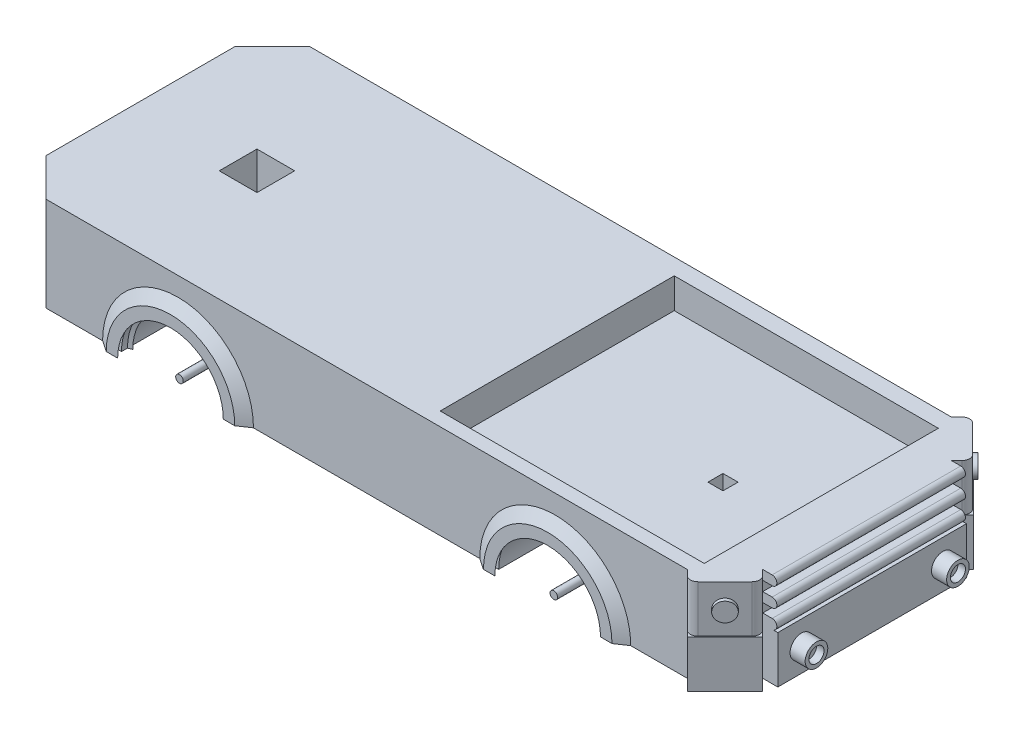
from build123d import *

# Parameters (mm, degrees)
SKETCH1_W                                  = 150
SKETCH1_H                                  = 70
BOSS_EXTRUDE1_DEPTH                        = 25
CUT_EXTRUDE3_DEPTH                         = 30
MIRROR9_ANGLE                              = 180
SKETCH6_R                                  = 15
CUT_EXTRUDE4_DEPTH                         = 30
SKETCH10_W                                 = 70
SKETCH10_H                                 = 25
BOSS_EXTRUDE3_DEPTH                        = 20
CHAMFER3_SIZE                              = 10
CHAMFER4_SIZE                              = 10
SKETCH11_W                                 = 14.142135624
SKETCH11_H                                 = 12.5
BOSS_EXTRUDE4_DEPTH                        = 4
SKETCH12_W                                 = 14.142135624
SKETCH12_H                                 = 12.5
BOSS_EXTRUDE5_DEPTH                        = 4.2
FILLET1_R                                  = 2
FILLET2_R                                  = 2
FILLET4_R                                  = 2
FILLET5_R                                  = 2
SKETCH13_W                                 = 50
SKETCH13_H                                 = 2.5
BOSS_EXTRUDE6_DEPTH                        = 2.5
BOSS_EXTRUDE8_DEPTH                        = 50
BOSS_EXTRUDE10_DEPTH                       = 50
SKETCH16_W                                 = 50
SKETCH16_H                                 = 12.5
BOSS_EXTRUDE11_DEPTH                       = 4
SKETCH17_R                                 = 3
BOSS_EXTRUDE12_DEPTH                       = 4
SKETCH18_R                                 = 2
CUT_EXTRUDE5_DEPTH                         = 2
SKETCH22_W                                 = 70
SKETCH22_H                                 = 25
BOSS_EXTRUDE13_DEPTH                       = 20
SKETCH27_W                                 = 19
SKETCH27_H                                 = 5.69724291
SKETCH27_W_2                               = 18
SKETCH27_W_3                               = 18.103539807
BOSS_EXTRUDE16_DEPTH                       = 1
SKETCH28_R                                 = 2.5
BOSS_EXTRUDE17_DEPTH                       = 1
CUT_EXTRUDE7_DEPTH                         = 30
SKETCH33_W                                 = 70
SKETCH33_H                                 = 62.057932372
CUT_EXTRUDE9_DEPTH                         = 8
SKETCH34_W                                 = 10
SKETCH34_H                                 = 10
CUT_EXTRUDE10_DEPTH                        = 10
MIRROR13_START                             = 170
MIRROR13_OUTLINE_R                         = 2
MIRROR13_DEPTH                             = 2
CHAMFER5_SIZE                              = 10
CHAMFER6_SIZE                              = 10
SKETCH35_R                                 = 3
BOSS_EXTRUDE18_DEPTH                       = 2
SKETCH38_R                                 = 2
CUT_EXTRUDE11_DEPTH                        = 1
MIRROR16_START                             = -21
MIRROR16_OUTLINE_R                         = 2
MIRROR16_DEPTH                             = 1
MIRROR16_START_2                           = -22
MIRROR16_2_OUTLINE_R                       = 3
MIRROR16_2_OUTLINE_R_2                     = 2
MIRROR16_2_DEPTH                           = 2
MIRROR16_3_OUTLINE_R                       = 2
MIRROR16_3_DEPTH                           = 1
SKETCH39_R                                 = 2
CUT_EXTRUDE12_DEPTH                        = 1
SKETCH40_W                                 = 4
SKETCH40_H                                 = 4
CUT_EXTRUDE13_DEPTH                        = 5
SKETCH41_R                                 = 1
BOSS_EXTRUDE19_DEPTH                       = 30
MIRROR17_AT_THE_SECOND_PLANE_COPY_1_SKET_R = 1
MIRROR17_AT_THE_SECOND_PLANE_COPY_1_DEPTH  = 30
SCALE1_SCALE                               = 0.9


# Read off the part's stored shape, not the designer's step: Mirror9, Mirror13, Mirror16
with BuildPart() as part:
    # Sketch1 → Boss-Extrude1 (new body)
    with BuildSketch(Plane(origin=(0, 0, 0), x_dir=(1, 0, 0), z_dir=(0, 1, 0))):
        with Locations((75, 35)):
            Rectangle(SKETCH1_W, SKETCH1_H)
    extrude(amount=BOSS_EXTRUDE1_DEPTH)

    # Sketch2 → Cut-Extrude3 (cut)
    with BuildSketch(Plane.XY):
        with BuildLine():
            ThreePointArc((40, 0), (25, 15), (10, 0))
            Line((10, 0), (40, 0))
        make_face()
    extrude(amount=-CUT_EXTRUDE3_DEPTH, mode=Mode.SUBTRACT)

    # Sketch4 → Loft2 section 0
    with BuildSketch(Plane.XY):
        with BuildLine():
            Line((5, 0), (6, 0))
            ThreePointArc((6, 0), (25, 19), (44, 0))
            Line((44, 0), (45, 0))
            ThreePointArc((45, 0), (25, 20), (5, 0))
        make_face()
    # Sketch3 → Loft2 section 1
    with BuildSketch(Plane.XY.offset(2)):
        with BuildLine():
            Line((39, 0), (42.033465093, 0))
            ThreePointArc((42.033465093, 0), (25, 17.033465093), (7.966534907, 0))
            Line((7.966534907, 0), (11, 0))
            ThreePointArc((11, 0), (25, 14), (39, 0))
        make_face()
    loft2 = loft()

    # Mirror4: Loft2 across plane
    add(loft2.mirror(Plane(origin=(0, 25, 0), x_dir=(1, 0, 0), z_dir=(0, 0, -1))))

    # Mirror5: Loft2 across plane
    add(loft2.mirror(Plane.ZY.offset(-75)))

    # Mirror8: Loft2 across plane
    add(loft2.mirror(Plane(origin=(0, 0, -35), x_dir=(1, 0, 0), z_dir=(0, 0, -1))))

    # Mirror9 outline → Mirror9 (revolve)
    with BuildSketch(Plane(origin=(125, 0, 0), x_dir=(1, 0, 0), z_dir=(0, -1, 0))):
        Polygon((19, -70), (14, -72), (17.033465093, -72), (20, -70), align=None)
    revolve(axis=Axis((125, 0, 0), (0, 0, 1)), revolution_arc=MIRROR9_ANGLE)

    # Sketch6 → Cut-Extrude4 (cut)
    with BuildSketch(Plane.XY):
        with Locations((125, 0)):
            Circle(SKETCH6_R)
    extrude(amount=-CUT_EXTRUDE4_DEPTH, mode=Mode.SUBTRACT)

    # Sketch10 → Boss-Extrude3 (add)
    with BuildSketch(Plane(origin=(150, 0, 0), x_dir=(0, 0, -1), z_dir=(1, 0, 0))):
        with Locations((35, 12.5)):
            Rectangle(SKETCH10_W, SKETCH10_H)
    extrude(amount=BOSS_EXTRUDE3_DEPTH)

    # Chamfer3
    chamfer3_edges = [part.edges().sort_by_distance(p)[0] for p in [
        (170, 12.5, -70),
    ]]
    chamfer(chamfer3_edges, length=CHAMFER3_SIZE)

    # Chamfer4
    chamfer4_edges = [part.edges().sort_by_distance(p)[0] for p in [
        (170, 12.5, 0),
    ]]
    chamfer(chamfer4_edges, length=CHAMFER4_SIZE)

    # Sketch11 → Boss-Extrude4 (add)
    with BuildSketch(Plane(origin=(80, 0, 80), x_dir=(0.7071067811865485, 0, -0.7071067811865467), z_dir=(0.7071067811865467, 0, 0.7071067811865485))):
        with Locations((120.208152802, 18.75)):
            Rectangle(SKETCH11_W, SKETCH11_H)
    boss_extrude4 = extrude(amount=BOSS_EXTRUDE4_DEPTH)

    # Sketch12 → Boss-Extrude5 (add)
    with BuildSketch(Plane(origin=(80, 0, 80), x_dir=(0.7071067811865485, 0, -0.7071067811865467), z_dir=(0.7071067811865467, 0, 0.7071067811865485))):
        with Locations((120.208152802, 6.25)):
            Rectangle(SKETCH12_W, SKETCH12_H)
    boss_extrude5 = extrude(amount=BOSS_EXTRUDE5_DEPTH)

    # Fillet1
    fillet1_edges = [part.edges().sort_by_distance(p)[0] for p in [
        (172.828427125, 18.75, -7.171572875),
    ]]
    fillet(fillet1_edges, radius=FILLET1_R)

    # Fillet2
    fillet2_edges = [part.edges().sort_by_distance(p)[0] for p in [
        (162.828427125, 18.75, 2.828427125),
    ]]
    fillet(fillet2_edges, radius=FILLET2_R)

    # Mirror10: Boss-Extrude4, Boss-Extrude5 across plane
    add(boss_extrude4.mirror(Plane(origin=(0, 0, -35), x_dir=(1, 0, 0), z_dir=(0, 0, -1))))
    add(boss_extrude5.mirror(Plane(origin=(0, 0, -35), x_dir=(1, 0, 0), z_dir=(0, 0, -1))))

    # Fillet4
    fillet4_edges = [part.edges().sort_by_distance(p)[0] for p in [
        (172.828427125, 18.75, -62.828427125),
    ]]
    fillet(fillet4_edges, radius=FILLET4_R)

    # Fillet5
    fillet5_edges = [part.edges().sort_by_distance(p)[0] for p in [
        (162.828427125, 18.75, -72.828427125),
    ]]
    fillet(fillet5_edges, radius=FILLET5_R)

    # Sketch13 → Boss-Extrude6 (add)
    with BuildSketch(Plane(origin=(170, 0, 0), x_dir=(0, 0, -1), z_dir=(1, 0, 0))):
        with Locations((35, 13.75)):
            Rectangle(SKETCH13_W, SKETCH13_H)
        with Locations((35, 18.657877469)):
            Rectangle(SKETCH13_W, SKETCH13_H)
        with Locations((35, 23.75)):
            Rectangle(SKETCH13_W, SKETCH13_H)
    extrude(amount=BOSS_EXTRUDE6_DEPTH)

    # Sketch14 → Boss-Extrude8 (add)
    with BuildSketch(Plane(origin=(0, 0, -60), x_dir=(-1, 0, 0), z_dir=(0, 0, -1))):
        with BuildLine():
            Line((-172.5, 25), (-172.5, 22.5))
            ThreePointArc((-172.5, 22.5), (-173.75, 23.75), (-172.5, 25))
        make_face()
    extrude(amount=-BOSS_EXTRUDE8_DEPTH)

    # Sketch15 → Boss-Extrude10 (add)
    with BuildSketch(Plane(origin=(0, 0, -60), x_dir=(-1, 0, 0), z_dir=(0, 0, -1))):
        with BuildLine():
            Line((-172.5, 19.907877469), (-172.5, 17.407877469))
            ThreePointArc((-172.5, 17.407877469), (-173.75, 18.657877469), (-172.5, 19.907877469))
        make_face()
        with BuildLine():
            Line((-172.5, 15), (-172.5, 12.5))
            ThreePointArc((-172.5, 12.5), (-173.75, 13.75), (-172.5, 15))
        make_face()
    extrude(amount=-BOSS_EXTRUDE10_DEPTH)

    # Sketch16 → Boss-Extrude11 (add)
    with BuildSketch(Plane(origin=(170, 0, 0), x_dir=(0, 0, -1), z_dir=(1, 0, 0))):
        with Locations((35, 6.25)):
            Rectangle(SKETCH16_W, SKETCH16_H)
    extrude(amount=BOSS_EXTRUDE11_DEPTH)

    # Sketch17 → Boss-Extrude12 (add)
    with BuildSketch(Plane(origin=(174, 0, 0), x_dir=(0, 0, -1), z_dir=(1, 0, 0))):
        with Locations(Location((16.25, 6.25, 0), (0, 0, 180))):
            Circle(SKETCH17_R)
    boss_extrude12 = extrude(amount=BOSS_EXTRUDE12_DEPTH)

    # Sketch18 → Cut-Extrude5 (cut)
    with BuildSketch(Plane(origin=(178, 0, 0), x_dir=(0, 0, -1), z_dir=(1, 0, 0))):
        with Locations((16.25, 6.25)):
            Circle(SKETCH18_R)
    cut_extrude5 = extrude(amount=-CUT_EXTRUDE5_DEPTH, mode=Mode.SUBTRACT)

    # Mirror11: Boss-Extrude12, Cut-Extrude5 across plane
    add(boss_extrude12.mirror(Plane(origin=(0, 0, -35), x_dir=(1, 0, 0), z_dir=(0, 0, -1))))
    add(cut_extrude5.mirror(Plane(origin=(0, 0, -35), x_dir=(1, 0, 0), z_dir=(0, 0, -1))), mode=Mode.SUBTRACT)

    # Sketch20 → Loft6 section 0
    with BuildSketch(Plane(origin=(0, 0, -74), x_dir=(-1, 0, 0), z_dir=(0, 0, -1))):
        with BuildLine():
            Line((-103.402328068, 1.268636049), (-46.667284088, 1.268636049))
            Line((-46.667284088, 1.268636049), (-46.667284088, 6.965878959))
            Line((-46.667284088, 6.965878959), (-103.402328068, 6.965878959))
            Line((-103.402328068, 6.965878959), (-103.402328068, 1.268636049))
        make_face()
    # Sketch19 → Loft6 section 1
    with BuildSketch(Plane(origin=(0, 0, -70), x_dir=(-1, 0, 0), z_dir=(0, 0, -1))):
        with BuildLine():
            Line((-98.293308308, 2.695575189), (-51.720160157, 2.695575189))
            Line((-51.720160157, 2.695575189), (-51.720160157, 5.695575189))
            Line((-51.720160157, 5.695575189), (-98.293308308, 5.695575189))
            Line((-98.293308308, 5.695575189), (-98.293308308, 2.695575189))
        make_face()
    loft()

    # Sketch22 → Boss-Extrude13 (add)
    with BuildSketch(Plane.ZY):
        with Locations((-35, 12.5)):
            Rectangle(SKETCH22_W, SKETCH22_H)
    extrude(amount=BOSS_EXTRUDE13_DEPTH)

    # Sketch27 → Boss-Extrude16 (add)
    with BuildSketch(Plane(origin=(0, 0, -74), x_dir=(-1, 0, 0), z_dir=(0, 0, -1))):
        with Locations((-93.902328068, 4.117257504)):
            Rectangle(SKETCH27_W, SKETCH27_H)
        with Locations((-74.556974572, 4.117257504)):
            Rectangle(SKETCH27_W_2, SKETCH27_H)
        with Locations((-55.719053992, 4.117257504)):
            Rectangle(SKETCH27_W_3, SKETCH27_H)
    extrude(amount=BOSS_EXTRUDE16_DEPTH)

    # Sketch28 → Boss-Extrude17 (add)
    with BuildSketch(Plane(origin=(117.828427125, 0, -117.828427125), x_dir=(-0.707106781186548, 0, -0.7071067811865471), z_dir=(0.7071067811865471, 0, -0.707106781186548))):
        with Locations((-70.710678119, 18.75)):
            Circle(SKETCH28_R)
    boss_extrude17 = extrude(amount=BOSS_EXTRUDE17_DEPTH)

    # Mirror12: Boss-Extrude17 across plane
    add(boss_extrude17.mirror(Plane(origin=(0, 0, -35), x_dir=(1, 0, 0), z_dir=(0, 0, -1))))

    # Sketch30 → Cut-Extrude7 (cut)
    with BuildSketch(Plane(origin=(0, 0, -70), x_dir=(-1, 0, 0), z_dir=(0, 0, -1))):
        with BuildLine():
            Line((-139, 0), (-111, 0))
            ThreePointArc((-111, 0), (-125, 14), (-139, 0))
        make_face()
        with BuildLine():
            Line((-39, 0), (-11, 0))
            ThreePointArc((-11, 0), (-25, 14), (-39, 0))
        make_face()
    extrude(amount=-CUT_EXTRUDE7_DEPTH, mode=Mode.SUBTRACT)

    # Sketch33 → Cut-Extrude9 (cut)
    with BuildSketch(Plane(origin=(0, 25, 0), x_dir=(1, 0, 0), z_dir=(0, 1, 0))):
        with Locations((125.867652406, 34.655253088)):
            Rectangle(SKETCH33_W, SKETCH33_H)
    extrude(amount=-CUT_EXTRUDE9_DEPTH, mode=Mode.SUBTRACT)

    # Sketch34 → Cut-Extrude10 (cut)
    with BuildSketch(Plane(origin=(0, 25, 0), x_dir=(1, 0, 0), z_dir=(0, 1, 0))):
        with Locations((11.447582111, 34.476487315)):
            Rectangle(SKETCH34_W, SKETCH34_H)
    extrude(amount=-CUT_EXTRUDE10_DEPTH, mode=Mode.SUBTRACT)

    # Mirror13 outline → Mirror13 (cut)
    with BuildSketch(Plane.YZ.offset(MIRROR13_START)):
        with Locations((6.25, -16.25)):
            Circle(MIRROR13_OUTLINE_R)
        with Locations((6.25, -53.75)):
            Circle(MIRROR13_OUTLINE_R)
    extrude(amount=MIRROR13_DEPTH, mode=Mode.SUBTRACT)

    # Chamfer5
    chamfer5_edges = [part.edges().sort_by_distance(p)[0] for p in [
        (-20, 12.5, -70),
    ]]
    chamfer(chamfer5_edges, length=CHAMFER5_SIZE)

    # Chamfer6
    chamfer6_edges = [part.edges().sort_by_distance(p)[0] for p in [
        (-20, 12.5, 0),
    ]]
    chamfer(chamfer6_edges, length=CHAMFER6_SIZE)

    # Sketch35 → Boss-Extrude18 (add)
    with BuildSketch(Plane.ZY.offset(20)):
        with Locations(Location((-16.64024062, 6.25, 0), (0, 0, 180))):
            Circle(SKETCH35_R)
    extrude(amount=BOSS_EXTRUDE18_DEPTH)

    # Sketch38 → Cut-Extrude11 (cut)
    with BuildSketch(Plane.ZY.offset(22)):
        with Locations((-16.64024062, 6.25)):
            Circle(SKETCH38_R)
    extrude(amount=-CUT_EXTRUDE11_DEPTH, mode=Mode.SUBTRACT)

    # Mirror16 outline → Mirror16 (cut)
    with BuildSketch(Plane.YZ.offset(MIRROR16_START)):
        with Locations((6.25, -16.64024062)):
            Circle(MIRROR16_OUTLINE_R)
    extrude(amount=MIRROR16_DEPTH, mode=Mode.SUBTRACT)

    # Mirror16 2 outline → Mirror16 2 (add)
    with BuildSketch(Plane.YZ.offset(MIRROR16_START_2)):
        with Locations((6.25, -53.35975938)):
            Circle(MIRROR16_2_OUTLINE_R)
        with Locations((6.25, -53.35975938)):
            Circle(MIRROR16_2_OUTLINE_R_2, mode=Mode.SUBTRACT)
    extrude(amount=MIRROR16_2_DEPTH)

    # Mirror16 3 outline → Mirror16 3 (add)
    with BuildSketch(Plane.YZ.offset(MIRROR16_START_2)):
        with Locations((6.25, -16.64024062)):
            Circle(MIRROR16_3_OUTLINE_R)
    extrude(amount=MIRROR16_3_DEPTH)

    # Sketch39 → Cut-Extrude12 (cut)
    with BuildSketch(Plane.ZY.offset(22)):
        with Locations((-16.64024062, 6.25)):
            Circle(SKETCH39_R)
    extrude(amount=-CUT_EXTRUDE12_DEPTH, mode=Mode.SUBTRACT)

    # Sketch40 → Cut-Extrude13 (cut)
    with BuildSketch(Plane(origin=(0, 17, 0), x_dir=(1, 0, 0), z_dir=(0, 1, 0))):
        with Locations((136.691016332, 32.770544898)):
            Rectangle(SKETCH40_W, SKETCH40_H)
    extrude(amount=-CUT_EXTRUDE13_DEPTH, mode=Mode.SUBTRACT)

    # Sketch41 → Boss-Extrude19 (add)
    with BuildSketch(Plane(origin=(0, 0, -40), x_dir=(-1, 0, 0), z_dir=(0, 0, -1))):
        with Locations((-124.618458041, 1.416155078)):
            Circle(SKETCH41_R)
    boss_extrude19 = extrude(amount=BOSS_EXTRUDE19_DEPTH)

    # Mirror17: Boss-Extrude19 across plane
    add(boss_extrude19.mirror(Plane(origin=(0, 0, -35), x_dir=(1, 0, 0), z_dir=(0, 0, -1))))

    # Mirror17 at the second plane: Boss-Extrude19 across plane
    add(boss_extrude19.mirror(Plane.ZY.offset(-75)))

    # Mirror17 at the second plane copy 1 sket → Mirror17 at the second plane copy 1 (add)
    with BuildSketch(Plane(origin=(150, 0, -30), x_dir=(1, 0, 0), z_dir=(0, 0, 1))):
        with Locations((-124.618458041, 1.416155078)):
            Circle(MIRROR17_AT_THE_SECOND_PLANE_COPY_1_SKET_R)
    extrude(amount=MIRROR17_AT_THE_SECOND_PLANE_COPY_1_DEPTH)


with BuildPart() as part_1:
    # Scale1: scaled about (70.909489356, 12.206483662, -35.433386682)
    add(part.part.scale(SCALE1_SCALE).moved(Location((7.090948936, 1.220648366, -3.543338668))))


solid = part_1.part
